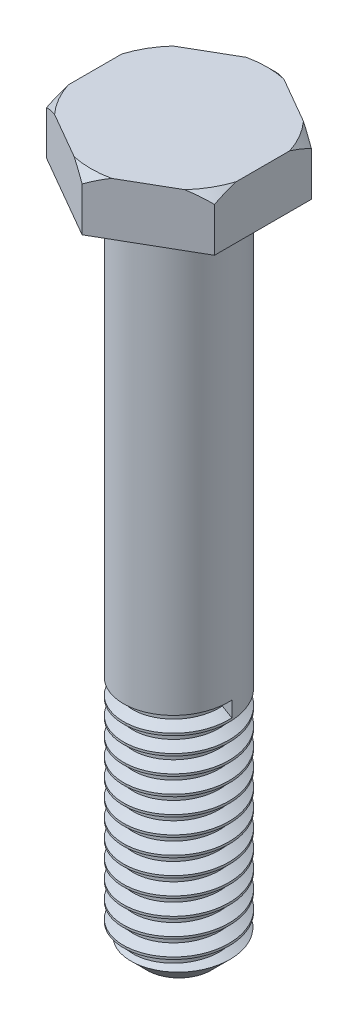
from build123d import *
from build123d.topology import SkipClean

# Parameters (mm, degrees)
SKETCH2_OUTSIDE_W  = 21.77
SKETCH2_OUTSIDE_H  = 21.77
CUT_EXTRUDE1_DEPTH = 10
THREAD2_PITCH      = 1


with BuildPart() as part:
    # Sketch1 → Revolve1 (revolve)
    with BuildSketch(Plane.XY, mode=Mode.PRIVATE) as revolve1_sk:
        Polygon((-3, 38), (-5.5, 38), (-5.5, 41), (0, 41), (0, 0), (-3, 0), align=None)
    revolve(revolve1_sk.sketch.rotate(Axis((0, 41.730363507, 0), (0, -1, 0)), 270), axis=Axis((0, 41.730363507, 0), (0, -1, 0)))

    # Sketch2 outside → Cut-Extrude1 (cut)
    with BuildSketch(Plane(origin=(0, 41, 0), x_dir=(1, 0, 0), z_dir=(0, 1, 0))):
        Rectangle(SKETCH2_OUTSIDE_W, SKETCH2_OUTSIDE_H)
        Polygon((4.763139721, -2.75), (4.763139721, 2.75), (0, 5.5), (-4.763139721, 2.75), (-4.763139721, -2.75), (0, -5.5), align=None, mode=Mode.SUBTRACT)
    extrude(amount=-CUT_EXTRUDE1_DEPTH, mode=Mode.SUBTRACT)

    # Sketch3 → Cut-Revolve1 (revolve, cut)
    with BuildSketch(Plane(origin=(0, 0, 0), x_dir=(0, 0, -1), z_dir=(1, 0, 0))):
        Polygon((-5, 41), (-5.5, 40.5), (-5.5, 41), align=None)
    revolve(axis=Axis((0, 43.508665001, 0), (0, -1, 0)), mode=Mode.SUBTRACT)

    # Thread2: the profile of Thread Profile2 profile screwed along a right-hand helix of 13 turns, 8 arcs to a turn; built about Z, then put on its axis
    with SkipClean():  # the faces are left unmerged after this step: merging them gives an invalid solid
        thread2_z = Axis((0, 0, 0), (0, 0, 1))
        thread2_corners = [(3.0003, 0, -0.000173205), (3.0003, 0, 0.875173202), (2.458734125, 0, 0.562499999), (2.458734125, 0, 0.312499999)]
        with BuildLine(mode=Mode.PRIVATE) as thread2_profile:
            Line(thread2_corners[0], thread2_corners[1])
            Line(thread2_corners[1], thread2_corners[2])
            Line(thread2_corners[2], thread2_corners[3])
            Line(thread2_corners[3], thread2_corners[0])
        thread2_cap = Face(thread2_profile.wire())
        thread2_turn_angles = [0, 22.5, 45, 67.5, 90, 112.5, 135, 157.5, 180, 202.5, 225, 247.5, 270, 292.5, 315, 337.5, 360]
        thread2_turn_weights = [1, 0.9238795325112867, 1, 0.9238795325112867, 1, 0.9238795325112867, 1, 0.9238795325112867, 1, 0.9238795325112867, 1, 0.9238795325112867, 1, 0.9238795325112867, 1, 0.9238795325112867, 1]
        thread2_turn_rails = [Edge.make_bspline([Vector(p[0], p[1], 0).rotate(thread2_z, thread2_turn_angles[k]) / thread2_turn_weights[k] + Vector(0, 0, p[2] + THREAD2_PITCH * thread2_turn_angles[k] / 360) for k in range(17)], [0, 0, 0, 1, 1, 2, 2, 3, 3, 4, 4, 5, 5, 6, 6, 7, 7, 8, 8, 8], 2, thread2_turn_weights) for p in thread2_corners]
        thread2_turn_sides = [Face.make_surface_from_curves(thread2_turn_rails[p[0]], thread2_turn_rails[p[1]]) for p in [(0, 1), (1, 2), (2, 3), (3, 0)]]
        thread2 = Plane(origin=(0, 0, 0), x_dir=(1, 0, 0), z_dir=(0, 1, 0)) * Solid(Shell([*[p.moved(Location((0, 0, THREAD2_PITCH * i))) for i in range(13) for p in thread2_turn_sides], thread2_cap, thread2_cap.rotate(thread2_z, 4680).moved(Location((0, 0, THREAD2_PITCH * 4680 / 360)))]))
        add(thread2, mode=Mode.SUBTRACT)

    # Sketch18 → Cut-Revolve3 (revolve, cut)
    with BuildSketch(Plane(origin=(0, 0, 0), x_dir=(0, 0, -1), z_dir=(1, 0, 0)), mode=Mode.PRIVATE) as cut_revolve3_sk:
        Polygon((3.311794423, 1.490448121), (1.514457285, -0.301494093), (3.468210897, -0.301494093), align=None)
    revolve(cut_revolve3_sk.sketch.rotate(Axis((0, -0.586072271, 0), (0, 1, 0)), 180), axis=Axis((0, -0.586072271, 0), (0, 1, 0)), mode=Mode.SUBTRACT)


solid = part.part
